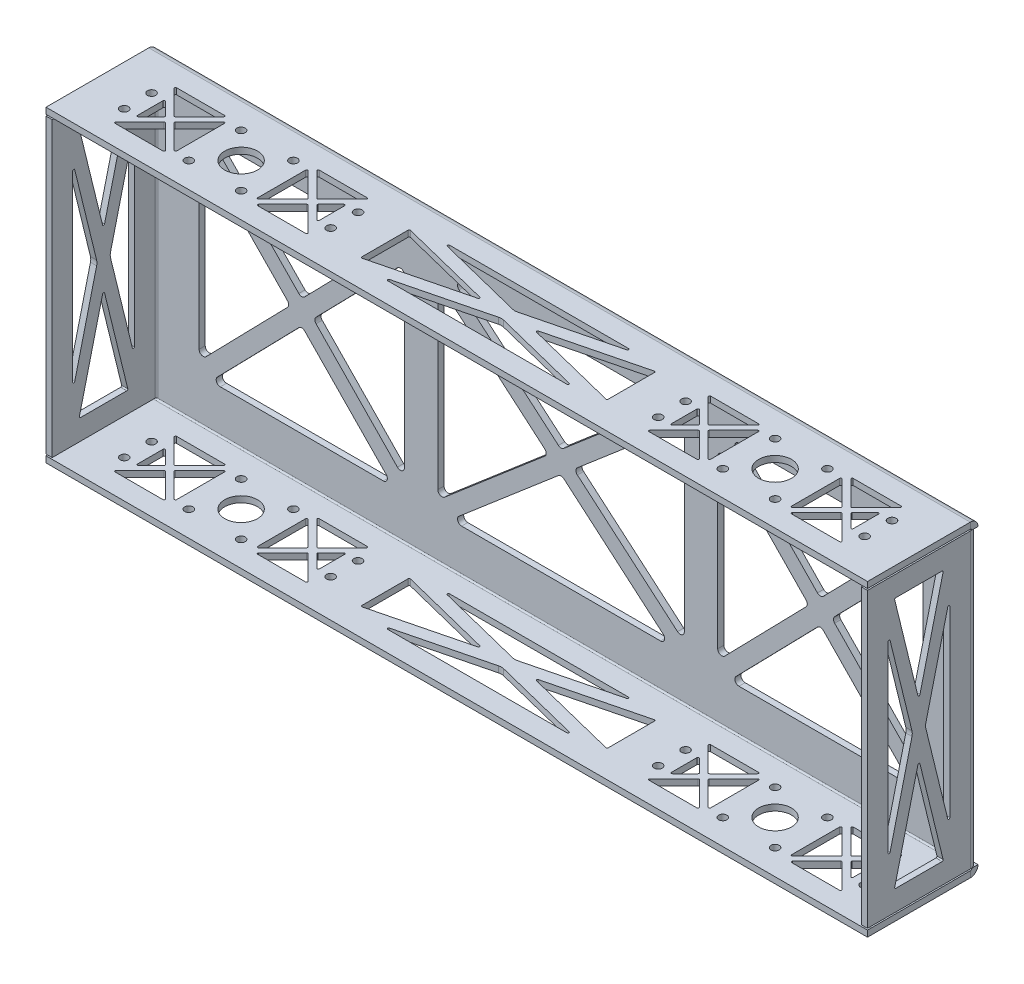
from build123d import *

# Parameters (mm, degrees)
SKETCH1_W                    = 400
SKETCH1_H                    = 150
BASE_FLANGE1_DEPTH           = 3
EDGE_FLANGE1_STRIP_W         = 13.4732
EDGE_FLANGE1_STRIP_H         = 3
EDGE_FLANGE1_STRIP_CUT_DEPTH = 400
EDGE_FLANGE1_DEPTH           = 400
EDGE_FLANGE2_STRIP_W         = 13.4732
EDGE_FLANGE2_STRIP_H         = 3
EDGE_FLANGE2_STRIP_CUT_DEPTH = 400
EDGE_FLANGE2_DEPTH           = 400
EDGE_FLANGE3_STRIP_W         = 13.4732
EDGE_FLANGE3_STRIP_H         = 3
EDGE_FLANGE3_STRIP_CUT_DEPTH = 142.5268
EDGE_FLANGE3_DEPTH           = 142.5268
EDGE_FLANGE4_STRIP_W         = 13.4732
EDGE_FLANGE4_STRIP_H         = 3
EDGE_FLANGE4_STRIP_CUT_DEPTH = 142.5268
EDGE_FLANGE4_DEPTH           = 142.5268
CUT_EXTRUDE1_DEPTH           = 256.109074711
CUT_EXTRUDE1_DEPTH_BACK      = 256.109074711
SKETCH18_R                   = 2
SKETCH18_R_2                 = 8
CUT_EXTRUDE2_DEPTH           = 220.557828373
CUT_EXTRUDE2_DEPTH_BACK      = 220.557828373
CUT_EXTRUDE3_DEPTH           = 411.128809034
CUT_EXTRUDE3_DEPTH_BACK      = 411.128809034
CUT_EXTRUDE4_DEPTH           = 256.109074711
CUT_EXTRUDE4_DEPTH_BACK      = 256.109074711
FILLET1_R                    = 2
FILLET2_R                    = 0.5
FILLET3_R                    = 0.5
FILLET4_R                    = 5


# Sheet-metal steps are written as plain solids
with BuildPart() as part:
    # Sketch1 → Base-Flange1 (new body)
    with BuildSketch(Plane.XY):
        Rectangle(SKETCH1_W, SKETCH1_H)
    extrude(amount=-BASE_FLANGE1_DEPTH)

    # Edge-Flange1 strip (across the edge) → Edge-Flange1 strip cut (cut)
    with BuildSketch(Plane(origin=(-200, -75, 0), x_dir=(0, 1, 0), z_dir=(1, 0, 0))):
        with Locations((-3, -1.5)):
            Rectangle(EDGE_FLANGE1_STRIP_W, EDGE_FLANGE1_STRIP_H)
    extrude(amount=EDGE_FLANGE1_STRIP_CUT_DEPTH, mode=Mode.SUBTRACT)

    # Edge-Flange1 section (across the edge) → Edge-Flange1 (add)
    with BuildSketch(Plane(origin=(-200, -75, 0), x_dir=(0, 1, 0), z_dir=(1, 0, 0))):
        with BuildLine():
            Line((0, 0.7366), (0, 50.8))
            Line((0, 50.8), (3, 50.8))
            Line((3, 50.8), (3, 0.7366))
            ThreePointArc((3, 0.7366), (3.215745145, 0.215745145), (3.7366, 0))
            Line((3.7366, 0), (3.7366, -3))
            ThreePointArc((3.7366, -3), (1.094424801, -1.905575199), (0, 0.7366))
        make_face()
    extrude(amount=EDGE_FLANGE1_DEPTH)

    # Edge-Flange2 strip (across the edge) → Edge-Flange2 strip cut (cut)
    with BuildSketch(Plane(origin=(200, 75, 0), x_dir=(0, -1, 0), z_dir=(-1, 0, 0))):
        with Locations((-3, -1.5)):
            Rectangle(EDGE_FLANGE2_STRIP_W, EDGE_FLANGE2_STRIP_H)
    extrude(amount=EDGE_FLANGE2_STRIP_CUT_DEPTH, mode=Mode.SUBTRACT)

    # Edge-Flange2 section (across the edge) → Edge-Flange2 (add)
    with BuildSketch(Plane(origin=(200, 75, 0), x_dir=(0, -1, 0), z_dir=(-1, 0, 0))):
        with BuildLine():
            Line((0, 0.7366), (0, 50.8))
            Line((0, 50.8), (3, 50.8))
            Line((3, 50.8), (3, 0.7366))
            ThreePointArc((3, 0.7366), (3.215745145, 0.215745145), (3.7366, 0))
            Line((3.7366, 0), (3.7366, -3))
            ThreePointArc((3.7366, -3), (1.094424801, -1.905575199), (0, 0.7366))
        make_face()
    extrude(amount=EDGE_FLANGE2_DEPTH)

    # Edge-Flange3 strip (across the edge) → Edge-Flange3 strip cut (cut)
    with BuildSketch(Plane(origin=(-200, 71.2634, 0), x_dir=(1, 0, 0), z_dir=(0, -1, 0))):
        with Locations((-3, -1.5)):
            Rectangle(EDGE_FLANGE3_STRIP_W, EDGE_FLANGE3_STRIP_H)
    extrude(amount=EDGE_FLANGE3_STRIP_CUT_DEPTH, mode=Mode.SUBTRACT)

    # Edge-Flange3 section (across the edge) → Edge-Flange3 (add)
    with BuildSketch(Plane(origin=(-200, 71.2634, 0), x_dir=(1, 0, 0), z_dir=(0, -1, 0))):
        with BuildLine():
            Line((0, 0.7366), (0, 50.8))
            Line((0, 50.8), (3, 50.8))
            Line((3, 50.8), (3, 0.7366))
            ThreePointArc((3, 0.7366), (3.215745145, 0.215745145), (3.7366, 0))
            Line((3.7366, 0), (3.7366, -3))
            ThreePointArc((3.7366, -3), (1.094424801, -1.905575199), (0, 0.7366))
        make_face()
    extrude(amount=EDGE_FLANGE3_DEPTH)

    # Edge-Flange4 strip (across the edge) → Edge-Flange4 strip cut (cut)
    with BuildSketch(Plane(origin=(200, -71.2634, 0), x_dir=(-1, 0, 0), z_dir=(0, 1, 0))):
        with Locations((-3, -1.5)):
            Rectangle(EDGE_FLANGE4_STRIP_W, EDGE_FLANGE4_STRIP_H)
    extrude(amount=EDGE_FLANGE4_STRIP_CUT_DEPTH, mode=Mode.SUBTRACT)

    # Edge-Flange4 section (across the edge) → Edge-Flange4 (add)
    with BuildSketch(Plane(origin=(200, -71.2634, 0), x_dir=(-1, 0, 0), z_dir=(0, 1, 0))):
        with BuildLine():
            Line((0, 0.7366), (0, 50.8))
            Line((0, 50.8), (3, 50.8))
            Line((3, 50.8), (3, 0.7366))
            ThreePointArc((3, 0.7366), (3.215745145, 0.215745145), (3.7366, 0))
            Line((3.7366, 0), (3.7366, -3))
            ThreePointArc((3.7366, -3), (1.094424801, -1.905575199), (0, 0.7366))
        make_face()
    extrude(amount=EDGE_FLANGE4_DEPTH)

    # Sketch18 → Cut-Extrude1 (cut, two sides: drawn at the far end of the back side and taken through both)
    with BuildSketch(Plane(origin=(0, -75, 0), x_dir=(-1, 0, 0), z_dir=(0, -1, 0)).offset(-CUT_EXTRUDE1_DEPTH_BACK)):
        with Locations(Location((142.727922061, -38.527922061, 0), (0, 0, 90))):
            Circle(SKETCH18_R)
        with Locations(Location((117.272077939, -38.527922061, 0), (0, 0, 90))):
            Circle(SKETCH18_R)
        with Locations(Location((117.272077939, -13.072077939, 0), (0, 0, 90))):
            Circle(SKETCH18_R)
        with Locations(Location((142.727922061, -13.072077939, 0), (0, 0, 90))):
            Circle(SKETCH18_R)
        with Locations(Location((180.2634, -19.133333333, 0), (0, 0, 90))):
            Circle(SKETCH18_R)
        with Locations(Location((180.2634, -32.466666667, 0), (0, 0, 90))):
            Circle(SKETCH18_R)
        with Locations(Location((79.7366, -19.133333333, 0), (0, 0, 90))):
            Circle(SKETCH18_R)
        with Locations(Location((79.7366, -32.466666667, 0), (0, 0, 90))):
            Circle(SKETCH18_R)
        with Locations(Location((-79.7366, -32.466666667, 0), (0, 0, 90))):
            Circle(SKETCH18_R)
        with Locations(Location((-79.7366, -19.133333333, 0), (0, 0, 90))):
            Circle(SKETCH18_R)
        with Locations(Location((-180.2634, -32.466666667, 0), (0, 0, 90))):
            Circle(SKETCH18_R)
        with Locations(Location((-180.2634, -19.133333333, 0), (0, 0, 90))):
            Circle(SKETCH18_R)
        with Locations(Location((-142.727922061, -13.072077939, 0), (0, 0, 90))):
            Circle(SKETCH18_R)
        with Locations(Location((-117.272077939, -13.072077939, 0), (0, 0, 90))):
            Circle(SKETCH18_R)
        with Locations(Location((-117.272077939, -38.527922061, 0), (0, 0, 90))):
            Circle(SKETCH18_R)
        with Locations(Location((-142.727922061, -38.527922061, 0), (0, 0, 90))):
            Circle(SKETCH18_R)
        with Locations(Location((130, -25.8, 0), (0, 0, 90))):
            Circle(SKETCH18_R_2)
        with Locations(Location((-130, -25.8, 0), (0, 0, 90))):
            Circle(SKETCH18_R_2)
    extrude(amount=CUT_EXTRUDE1_DEPTH + CUT_EXTRUDE1_DEPTH_BACK, mode=Mode.SUBTRACT)

    # Sketch20 → Cut-Extrude2 (cut, two sides: drawn at the far end of the back side and taken through both)
    with BuildSketch(Plane.XY.offset(-CUT_EXTRUDE2_DEPTH_BACK)):
        Polygon((-170.675818252, -51.2634), (-126.2634, -5.728768764), (-81.850981748, -51.2634), align=None)
        Polygon((-176.2634, -45.534631236), (-131.850981748, 0), (-176.2634, 45.534631236), align=None)
        Polygon((-170.675818252, 51.2634), (-126.2634, 5.728768764), (-81.850981748, 51.2634), align=None)
        Polygon((-76.2634, 45.534631236), (-120.675818252, 0), (-76.2634, -45.534631236), align=None)
        Polygon((-53.842213019, -51.2634), (0, -5.261151619), (53.842213019, -51.2634), align=None)
        Polygon((-60, -46.002248381), (-6.157786981, 0), (-60, 46.002248381), align=None)
        Polygon((-53.842213019, 51.2634), (0, 5.261151619), (53.842213019, 51.2634), align=None)
        Polygon((60, 46.002248381), (6.157786981, 0), (60, -46.002248381), align=None)
        Polygon((81.850981748, -51.2634), (126.2634, -5.728768764), (170.675818252, -51.2634), align=None)
        Polygon((76.2634, -45.534631236), (120.675818252, 0), (76.2634, 45.534631236), align=None)
        Polygon((81.850981748, 51.2634), (126.2634, 5.728768764), (170.675818252, 51.2634), align=None)
        Polygon((176.2634, 45.534631236), (131.850981748, 0), (176.2634, -45.534631236), align=None)
    extrude(amount=CUT_EXTRUDE2_DEPTH + CUT_EXTRUDE2_DEPTH_BACK, mode=Mode.SUBTRACT)

    # Sketch21 → Cut-Extrude3 (cut, two sides: drawn at the far end of the back side and taken through both)
    with BuildSketch(Plane.ZY.offset(200).offset(-CUT_EXTRUDE3_DEPTH_BACK)):
        Polygon((13.825583952, -61.2634), (25.7683, -12.589504808), (37.711016048, -61.2634), align=None)
        Polygon((10.7366, -48.673895192), (22.679316048, 0), (10.7366, 48.673895192), align=None)
        Polygon((13.825583952, 61.2634), (25.7683, 12.589504808), (37.711016048, 61.2634), align=None)
        Polygon((40.8, 48.673895192), (28.857283952, 0), (40.8, -48.673895192), align=None)
    extrude(amount=CUT_EXTRUDE3_DEPTH + CUT_EXTRUDE3_DEPTH_BACK, mode=Mode.SUBTRACT)

    # Sketch22 → Cut-Extrude4 (cut, two sides: drawn at the far end of the back side and taken through both)
    with BuildSketch(Plane.XZ.offset(75).offset(-CUT_EXTRUDE4_DEPTH_BACK)):
        Polygon((60, 13.82931402), (12.344767473, 25.7683), (60, 37.70728598), align=None)
        Polygon((47.655232527, 10.7366), (0, 22.67558598), (-47.655232527, 10.7366), align=None)
        Polygon((-60, 13.82931402), (-12.344767473, 25.7683), (-60, 37.70728598), align=None)
        Polygon((-47.655232527, 40.8), (0, 28.86101402), (47.655232527, 40.8), align=None)
        Polygon((177.606601718, 40.8), (164.727922061, 27.921320344), (151.849242405, 40.8), align=None)
        Polygon((-82.393398282, 40.8), (-95.272077939, 27.921320344), (-108.150757595, 40.8), align=None)
        Polygon((-85.7366, 33.214157595), (-93.150757595, 25.8), (-85.7366, 18.385842405), align=None)
        Polygon((95.272077939, 23.678679656), (82.393398282, 10.8), (108.150757595, 10.8), align=None)
        Polygon((174.2634, 33.214157595), (166.849242405, 25.8), (174.2634, 18.385842405), align=None)
        Polygon((162.606601718, 25.8), (149.727922061, 38.678679656), (149.727922061, 12.921320344), align=None)
        Polygon((164.727922061, 23.678679656), (151.849242405, 10.8), (177.606601718, 10.8), align=None)
        Polygon((110.272077939, 12.921320344), (97.393398282, 25.8), (110.272077939, 38.678679656), align=None)
        Polygon((85.7366, 18.385842405), (85.7366, 33.214157595), (93.150757595, 25.8), align=None)
        Polygon((108.150757595, 40.8), (95.272077939, 27.921320344), (82.393398282, 40.8), align=None)
        Polygon((-97.393398282, 25.8), (-110.272077939, 38.678679656), (-110.272077939, 12.921320344), align=None)
        Polygon((-164.727922061, 23.678679656), (-177.606601718, 10.8), (-151.849242405, 10.8), align=None)
        Polygon((-149.727922061, 12.921320344), (-162.606601718, 25.8), (-149.727922061, 38.678679656), align=None)
        Polygon((-174.2634, 18.385842405), (-174.2634, 33.214157595), (-166.849242405, 25.8), align=None)
        Polygon((-95.272077939, 23.678679656), (-108.150757595, 10.8), (-82.393398282, 10.8), align=None)
        Polygon((-151.849242405, 40.8), (-164.727922061, 27.921320344), (-177.606601718, 40.8), align=None)
    extrude(amount=CUT_EXTRUDE4_DEPTH + CUT_EXTRUDE4_DEPTH_BACK, mode=Mode.SUBTRACT)

    # Fillet1
    fillet1_edges = [part.edges().sort_by_distance(p)[0] for p in [
        (-53.842213019, 51.2634, -1.5),
        (53.842213019, 51.2634, -1.5),
        (0, 5.261151619, -1.5),
        (-60, -46.002248381, -1.5),
        (-60, 46.002248381, -1.5),
        (-6.157786981, 0, -1.5),
        (60, 46.002248381, -1.5),
        (60, -46.002248381, -1.5),
        (6.157786981, 0, -1.5),
        (170.675818252, -51.2634, -1.5),
        (81.850981748, -51.2634, -1.5),
        (126.2634, -5.728768764, -1.5),
        (-170.675818252, 51.2634, -1.5),
        (-81.850981748, 51.2634, -1.5),
        (-126.2634, 5.728768764, -1.5),
        (-176.2634, -45.534631236, -1.5),
        (-176.2634, 45.534631236, -1.5),
        (-131.850981748, 0, -1.5),
        (-76.2634, 45.534631236, -1.5),
        (-76.2634, -45.534631236, -1.5),
        (-120.675818252, 0, -1.5),
        (53.842213019, -51.2634, -1.5),
        (-53.842213019, -51.2634, -1.5),
        (0, -5.261151619, -1.5),
        (176.2634, 45.534631236, -1.5),
        (176.2634, -45.534631236, -1.5),
        (131.850981748, 0, -1.5),
        (76.2634, -45.534631236, -1.5),
        (76.2634, 45.534631236, -1.5),
        (120.675818252, 0, -1.5),
        (81.850981748, 51.2634, -1.5),
        (170.675818252, 51.2634, -1.5),
        (126.2634, 5.728768764, -1.5),
        (-81.850981748, -51.2634, -1.5),
        (-170.675818252, -51.2634, -1.5),
        (-126.2634, -5.728768764, -1.5),
    ]]
    fillet(fillet1_edges, radius=FILLET1_R)

    # Fillet2
    fillet2_edges = [part.edges().sort_by_distance(p)[0] for p in [
        (-198.5, 48.673895192, 40.8),
        (-198.5, -48.673895192, 40.8),
        (198.5, 48.673895192, 40.8),
        (198.5, -48.673895192, 40.8),
        (-198.5, -12.589504808, 25.7683),
        (198.5, -12.589504808, 25.7683),
        (-12.344767473, -73.5, 25.7683),
        (-12.344767473, 73.5, 25.7683),
        (47.655232527, -73.5, 10.7366),
        (-47.655232527, -73.5, 10.7366),
        (47.655232527, 73.5, 10.7366),
        (-47.655232527, 73.5, 10.7366),
        (-47.655232527, -73.5, 40.8),
        (47.655232527, -73.5, 40.8),
        (-47.655232527, 73.5, 40.8),
        (47.655232527, 73.5, 40.8),
        (12.344767473, -73.5, 25.7683),
        (12.344767473, 73.5, 25.7683),
        (-198.5, 12.589504808, 25.7683),
        (198.5, 12.589504808, 25.7683),
        (-198.5, -48.673895192, 10.7366),
        (-198.5, 48.673895192, 10.7366),
        (198.5, -48.673895192, 10.7366),
        (198.5, 48.673895192, 10.7366),
    ]]
    fillet(fillet2_edges, radius=FILLET2_R)

    # Fillet3
    fillet3_edges = [part.edges().sort_by_distance(p)[0] for p in [
        (-198.5, -61.2634, 37.711016048),
        (-198.5, -61.2634, 13.825583952),
        (198.5, -61.2634, 37.711016048),
        (198.5, -61.2634, 13.825583952),
        (110.272077939, -73.5, 38.678679656),
        (110.272077939, -73.5, 12.921320344),
        (97.393398282, -73.5, 25.8),
        (110.272077939, 73.5, 38.678679656),
        (110.272077939, 73.5, 12.921320344),
        (97.393398282, 73.5, 25.8),
        (95.272077939, -73.5, 23.678679656),
        (108.150757595, -73.5, 10.8),
        (82.393398282, -73.5, 10.8),
        (95.272077939, 73.5, 23.678679656),
        (108.150757595, 73.5, 10.8),
        (82.393398282, 73.5, 10.8),
        (174.2634, -73.5, 33.214157595),
        (174.2634, -73.5, 18.385842405),
        (166.849242405, -73.5, 25.8),
        (174.2634, 73.5, 33.214157595),
        (174.2634, 73.5, 18.385842405),
        (166.849242405, 73.5, 25.8),
        (93.150757595, -73.5, 25.8),
        (85.7366, -73.5, 18.385842405),
        (85.7366, -73.5, 33.214157595),
        (93.150757595, 73.5, 25.8),
        (85.7366, 73.5, 18.385842405),
        (85.7366, 73.5, 33.214157595),
        (-149.727922061, -73.5, 38.678679656),
        (-149.727922061, -73.5, 12.921320344),
        (-162.606601718, -73.5, 25.8),
        (-149.727922061, 73.5, 38.678679656),
        (-149.727922061, 73.5, 12.921320344),
        (-162.606601718, 73.5, 25.8),
        (-166.849242405, -73.5, 25.8),
        (-174.2634, -73.5, 18.385842405),
        (-174.2634, -73.5, 33.214157595),
        (-166.849242405, 73.5, 25.8),
        (-174.2634, 73.5, 18.385842405),
        (-174.2634, 73.5, 33.214157595),
        (-95.272077939, -73.5, 23.678679656),
        (-82.393398282, -73.5, 10.8),
        (-108.150757595, -73.5, 10.8),
        (-95.272077939, 73.5, 23.678679656),
        (-82.393398282, 73.5, 10.8),
        (-108.150757595, 73.5, 10.8),
        (-177.606601718, -73.5, 40.8),
        (-151.849242405, -73.5, 40.8),
        (-164.727922061, -73.5, 27.921320344),
        (-177.606601718, 73.5, 40.8),
        (-151.849242405, 73.5, 40.8),
        (-164.727922061, 73.5, 27.921320344),
        (-85.7366, -73.5, 33.214157595),
        (-85.7366, -73.5, 18.385842405),
        (-93.150757595, -73.5, 25.8),
        (-85.7366, 73.5, 33.214157595),
        (-85.7366, 73.5, 18.385842405),
        (-93.150757595, 73.5, 25.8),
        (-108.150757595, -73.5, 40.8),
        (-82.393398282, -73.5, 40.8),
        (-95.272077939, -73.5, 27.921320344),
        (-108.150757595, 73.5, 40.8),
        (-82.393398282, 73.5, 40.8),
        (-95.272077939, 73.5, 27.921320344),
        (-97.393398282, -73.5, 25.8),
        (-110.272077939, -73.5, 12.921320344),
        (-110.272077939, -73.5, 38.678679656),
        (-97.393398282, 73.5, 25.8),
        (-110.272077939, 73.5, 12.921320344),
        (-110.272077939, 73.5, 38.678679656),
        (-164.727922061, -73.5, 23.678679656),
        (-151.849242405, -73.5, 10.8),
        (-177.606601718, -73.5, 10.8),
        (-164.727922061, 73.5, 23.678679656),
        (-151.849242405, 73.5, 10.8),
        (-177.606601718, 73.5, 10.8),
        (-60, -73.5, 13.82931402),
        (-60, -73.5, 37.70728598),
        (-60, 73.5, 13.82931402),
        (-60, 73.5, 37.70728598),
        (151.849242405, -73.5, 40.8),
        (177.606601718, -73.5, 40.8),
        (164.727922061, -73.5, 27.921320344),
        (151.849242405, 73.5, 40.8),
        (177.606601718, 73.5, 40.8),
        (164.727922061, 73.5, 27.921320344),
        (177.606601718, -73.5, 10.8),
        (151.849242405, -73.5, 10.8),
        (164.727922061, -73.5, 23.678679656),
        (177.606601718, 73.5, 10.8),
        (151.849242405, 73.5, 10.8),
        (164.727922061, 73.5, 23.678679656),
        (149.727922061, -73.5, 12.921320344),
        (149.727922061, -73.5, 38.678679656),
        (162.606601718, -73.5, 25.8),
        (149.727922061, 73.5, 12.921320344),
        (149.727922061, 73.5, 38.678679656),
        (162.606601718, 73.5, 25.8),
        (82.393398282, -73.5, 40.8),
        (108.150757595, -73.5, 40.8),
        (95.272077939, -73.5, 27.921320344),
        (82.393398282, 73.5, 40.8),
        (108.150757595, 73.5, 40.8),
        (95.272077939, 73.5, 27.921320344),
        (60, -73.5, 37.70728598),
        (60, -73.5, 13.82931402),
        (60, 73.5, 37.70728598),
        (60, 73.5, 13.82931402),
        (-198.5, 61.2634, 13.825583952),
        (-198.5, 61.2634, 37.711016048),
        (198.5, 61.2634, 13.825583952),
        (198.5, 61.2634, 37.711016048),
    ]]
    fillet(fillet3_edges, radius=FILLET3_R)

    # Fillet4
    fillet4_edges = [part.edges().sort_by_distance(p)[0] for p in [
        (-198.5, 0, 28.857283952),
        (198.5, 0, 28.857283952),
        (0, -73.5, 22.67558598),
        (0, 73.5, 22.67558598),
        (0, -73.5, 28.86101402),
        (0, 73.5, 28.86101402),
        (-198.5, 0, 22.679316048),
        (198.5, 0, 22.679316048),
    ]]
    fillet(fillet4_edges, radius=FILLET4_R)


solid = part.part
